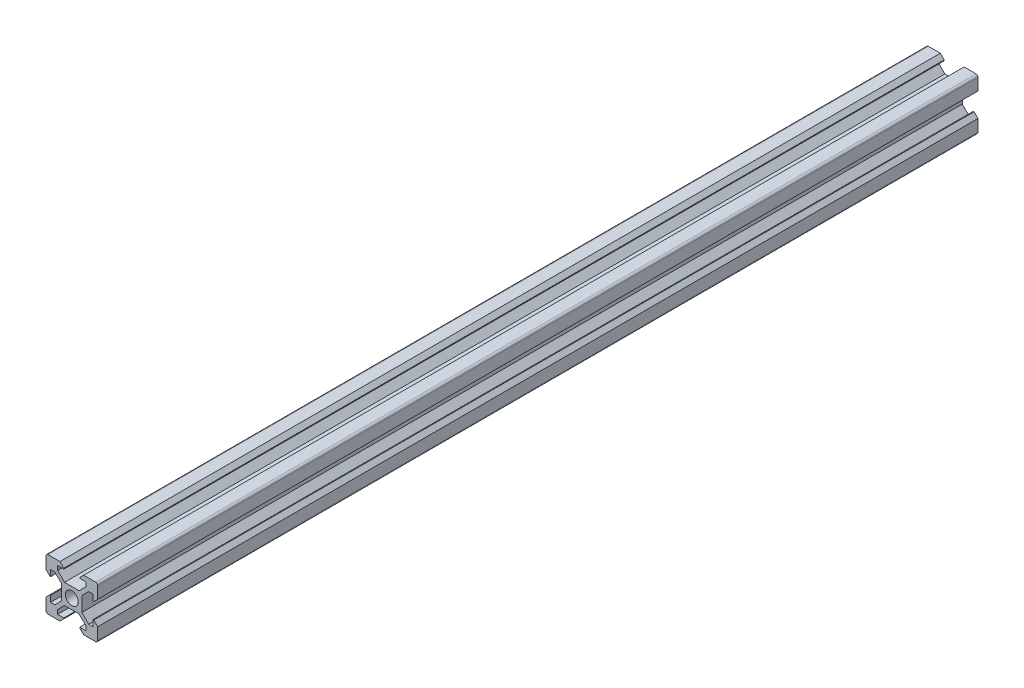
from build123d import *

# Parameters (mm, degrees)
CROQUIS1_R              = 2.5
SALIENTE_EXTRUIR1_DEPTH = 341.39


with BuildPart() as part:
    # Croquis1 → Saliente-Extruir1 (new body)
    with BuildSketch(Plane.XY):
        with BuildLine():
            Line((-4.6, 10), (-3.1, 8.5))
            Line((-3.1, 8.5), (-3.1, 8.2))
            Line((-3.1, 8.2), (-5.5, 8.2))
            Line((-5.5, 8.2), (-5.5, 6.560660172))
            Line((-5.5, 6.560660172), (-2.84, 3.900660172))
            Line((-2.84, 3.900660172), (0, 3.900660172))
            Line((0, 3.900660172), (2.84, 3.900660172))
            Line((2.84, 3.900660172), (5.5, 6.560660172))
            Line((5.5, 6.560660172), (5.5, 8.2))
            Line((5.5, 8.2), (3.1, 8.2))
            Line((3.1, 8.2), (3.1, 8.5))
            Line((3.1, 8.5), (4.6, 10))
            Line((4.6, 10), (9.25, 10))
            ThreePointArc((9.25, 10), (9.780330086, 9.780330086), (10, 9.25))
            Line((10, 9.25), (10, 4.6))
            Line((10, 4.6), (8.5, 3.1))
            Line((8.5, 3.1), (8.2, 3.1))
            Line((8.2, 3.1), (8.2, 5.5))
            Line((8.2, 5.5), (6.560660172, 5.5))
            Line((6.560660172, 5.5), (3.900660172, 2.84))
            Line((3.900660172, 2.84), (3.900660172, 0))
            Line((3.900660172, 0), (3.900660172, -2.84))
            Line((3.900660172, -2.84), (6.560660172, -5.5))
            Line((6.560660172, -5.5), (8.2, -5.5))
            Line((8.2, -5.5), (8.2, -3.1))
            Line((8.2, -3.1), (8.5, -3.1))
            Line((8.5, -3.1), (10, -4.6))
            Line((10, -4.6), (10, -9.25))
            ThreePointArc((10, -9.25), (9.780330086, -9.780330086), (9.25, -10))
            Line((9.25, -10), (4.6, -10))
            Line((4.6, -10), (3.1, -8.5))
            Line((3.1, -8.5), (3.1, -8.2))
            Line((3.1, -8.2), (5.5, -8.2))
            Line((5.5, -8.2), (5.5, -6.560660172))
            Line((5.5, -6.560660172), (2.84, -3.900660172))
            Line((2.84, -3.900660172), (0, -3.900660172))
            Line((0, -3.900660172), (-2.84, -3.900660172))
            Line((-2.84, -3.900660172), (-5.5, -6.560660172))
            Line((-5.5, -6.560660172), (-5.5, -8.2))
            Line((-5.5, -8.2), (-3.1, -8.2))
            Line((-3.1, -8.2), (-3.1, -8.5))
            Line((-3.1, -8.5), (-4.6, -10))
            Line((-4.6, -10), (-9.25, -10))
            ThreePointArc((-9.25, -10), (-9.780330086, -9.780330086), (-10, -9.25))
            Line((-10, -9.25), (-10, -4.6))
            Line((-10, -4.6), (-8.5, -3.1))
            Line((-8.5, -3.1), (-8.2, -3.1))
            Line((-8.2, -3.1), (-8.2, -5.5))
            Line((-8.2, -5.5), (-6.560660172, -5.5))
            Line((-6.560660172, -5.5), (-3.900660172, -2.84))
            Line((-3.900660172, -2.84), (-3.900660172, 0))
            Line((-3.900660172, 0), (-3.900660172, 2.84))
            Line((-3.900660172, 2.84), (-6.560660172, 5.5))
            Line((-6.560660172, 5.5), (-8.2, 5.5))
            Line((-8.2, 5.5), (-8.2, 3.1))
            Line((-8.2, 3.1), (-8.5, 3.1))
            Line((-8.5, 3.1), (-10, 4.6))
            Line((-10, 4.6), (-10, 9.25))
            ThreePointArc((-10, 9.25), (-9.780330086, 9.780330086), (-9.25, 10))
            Line((-9.25, 10), (-4.6, 10))
        make_face()
        Circle(CROQUIS1_R, mode=Mode.SUBTRACT)
    extrude(amount=SALIENTE_EXTRUIR1_DEPTH)


solid = part.part
